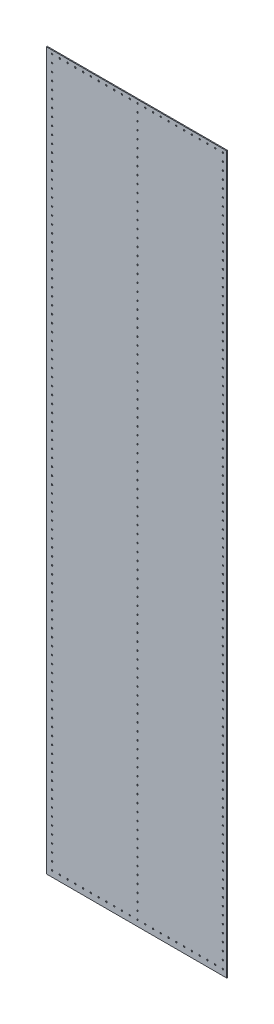
from build123d import *

# Parameters (mm, degrees)
BOSS_EXTRUDE1_DEPTH = 4613
CHAMFER1_SIZE       = 3
SKETCH4_R           = 4.7625
CUT_EXTRUDE1_DEPTH  = 4650.395309221


with BuildPart() as part:
    # Sketch3 → Boss-Extrude1 (new body)
    with BuildSketch(Plane(origin=(0, 0, 0), x_dir=(1, 0, 0), z_dir=(0, 1, 0))):
        Polygon((-578.87, 0), (578.87, 0), (580.602050808, 3), (-580.602050808, 3), align=None)
    extrude(amount=-BOSS_EXTRUDE1_DEPTH)

    # Chamfer1
    chamfer1_edges = [part.edges().sort_by_distance(p)[0] for p in [
        (0, 0, 0),
    ]]
    chamfer(chamfer1_edges, length=CHAMFER1_SIZE - 0.0001)  # a hair under: the kernel refuses the full size

    # Sketch4 → Cut-Extrude1 (cut, through all)
    with BuildSketch(Plane(origin=(0, 0, -3), x_dir=(-1, 0, 0), z_dir=(0, 0, -1))):
        with Locations((-555.602050808, -25)):
            Circle(SKETCH4_R)
        with Locations((-505.602050808, -25)):
            Circle(SKETCH4_R)
        with Locations((-455.602050808, -25)):
            Circle(SKETCH4_R)
        with Locations((-405.602050808, -25)):
            Circle(SKETCH4_R)
        with Locations((-355.602050808, -25)):
            Circle(SKETCH4_R)
        with Locations((-305.602050808, -25)):
            Circle(SKETCH4_R)
        with Locations((-255.602050808, -25)):
            Circle(SKETCH4_R)
        with Locations((-205.602050808, -25)):
            Circle(SKETCH4_R)
        with Locations((-155.602050808, -25)):
            Circle(SKETCH4_R)
        with Locations((-105.602050808, -25)):
            Circle(SKETCH4_R)
        with Locations((-55.602050808, -25)):
            Circle(SKETCH4_R)
        with Locations((-5.602050808, -25)):
            Circle(SKETCH4_R)
        with Locations((44.397949192, -25)):
            Circle(SKETCH4_R)
        with Locations((94.397949192, -25)):
            Circle(SKETCH4_R)
        with Locations((144.397949192, -25)):
            Circle(SKETCH4_R)
        with Locations((194.397949192, -25)):
            Circle(SKETCH4_R)
        with Locations((244.397949192, -25)):
            Circle(SKETCH4_R)
        with Locations((294.397949192, -25)):
            Circle(SKETCH4_R)
        with Locations((344.397949192, -25)):
            Circle(SKETCH4_R)
        with Locations((394.397949192, -25)):
            Circle(SKETCH4_R)
        with Locations((444.397949192, -25)):
            Circle(SKETCH4_R)
        with Locations((494.397949192, -25)):
            Circle(SKETCH4_R)
        with Locations((544.397949192, -25)):
            Circle(SKETCH4_R)
        with Locations((-555.602050808, -75)):
            Circle(SKETCH4_R)
        with Locations((-555.602050808, -125)):
            Circle(SKETCH4_R)
        with Locations((-555.602050808, -175)):
            Circle(SKETCH4_R)
        with Locations((-555.602050808, -225)):
            Circle(SKETCH4_R)
        with Locations((-555.602050808, -275)):
            Circle(SKETCH4_R)
        with Locations((-555.602050808, -325)):
            Circle(SKETCH4_R)
        with Locations((-555.602050808, -375)):
            Circle(SKETCH4_R)
        with Locations((-555.602050808, -425)):
            Circle(SKETCH4_R)
        with Locations((-555.602050808, -475)):
            Circle(SKETCH4_R)
        with Locations((-555.602050808, -525)):
            Circle(SKETCH4_R)
        with Locations((-555.602050808, -575)):
            Circle(SKETCH4_R)
        with Locations((-555.602050808, -625)):
            Circle(SKETCH4_R)
        with Locations((-555.602050808, -675)):
            Circle(SKETCH4_R)
        with Locations((-555.602050808, -725)):
            Circle(SKETCH4_R)
        with Locations((-555.602050808, -775)):
            Circle(SKETCH4_R)
        with Locations((-555.602050808, -825)):
            Circle(SKETCH4_R)
        with Locations((-555.602050808, -875)):
            Circle(SKETCH4_R)
        with Locations((-555.602050808, -925)):
            Circle(SKETCH4_R)
        with Locations((-555.602050808, -975)):
            Circle(SKETCH4_R)
        with Locations((-555.602050808, -1025)):
            Circle(SKETCH4_R)
        with Locations((-555.602050808, -1075)):
            Circle(SKETCH4_R)
        with Locations((-555.602050808, -1125)):
            Circle(SKETCH4_R)
        with Locations((-555.602050808, -1175)):
            Circle(SKETCH4_R)
        with Locations((-555.602050808, -1225)):
            Circle(SKETCH4_R)
        with Locations((-555.602050808, -1275)):
            Circle(SKETCH4_R)
        with Locations((-555.602050808, -1325)):
            Circle(SKETCH4_R)
        with Locations((-555.602050808, -1375)):
            Circle(SKETCH4_R)
        with Locations((-555.602050808, -1425)):
            Circle(SKETCH4_R)
        with Locations((-555.602050808, -1475)):
            Circle(SKETCH4_R)
        with Locations((-555.602050808, -1525)):
            Circle(SKETCH4_R)
        with Locations((-555.602050808, -1575)):
            Circle(SKETCH4_R)
        with Locations((-555.602050808, -1625)):
            Circle(SKETCH4_R)
        with Locations((-555.602050808, -1675)):
            Circle(SKETCH4_R)
        with Locations((-555.602050808, -1725)):
            Circle(SKETCH4_R)
        with Locations((-555.602050808, -1775)):
            Circle(SKETCH4_R)
        with Locations((-555.602050808, -1825)):
            Circle(SKETCH4_R)
        with Locations((-555.602050808, -1875)):
            Circle(SKETCH4_R)
        with Locations((-555.602050808, -1925)):
            Circle(SKETCH4_R)
        with Locations((-555.602050808, -1975)):
            Circle(SKETCH4_R)
        with Locations((-555.602050808, -2025)):
            Circle(SKETCH4_R)
        with Locations((-555.602050808, -2075)):
            Circle(SKETCH4_R)
        with Locations((-555.602050808, -2125)):
            Circle(SKETCH4_R)
        with Locations((-555.602050808, -2175)):
            Circle(SKETCH4_R)
        with Locations((-555.602050808, -2225)):
            Circle(SKETCH4_R)
        with Locations((-555.602050808, -2275)):
            Circle(SKETCH4_R)
        with Locations((-555.602050808, -2325)):
            Circle(SKETCH4_R)
        with Locations((-555.602050808, -2375)):
            Circle(SKETCH4_R)
        with Locations((-555.602050808, -2425)):
            Circle(SKETCH4_R)
        with Locations((-555.602050808, -2475)):
            Circle(SKETCH4_R)
        with Locations((-555.602050808, -2525)):
            Circle(SKETCH4_R)
        with Locations((-555.602050808, -2575)):
            Circle(SKETCH4_R)
        with Locations((-555.602050808, -2625)):
            Circle(SKETCH4_R)
        with Locations((-555.602050808, -2675)):
            Circle(SKETCH4_R)
        with Locations((-555.602050808, -2725)):
            Circle(SKETCH4_R)
        with Locations((-555.602050808, -2775)):
            Circle(SKETCH4_R)
        with Locations((-555.602050808, -2825)):
            Circle(SKETCH4_R)
        with Locations((-555.602050808, -2875)):
            Circle(SKETCH4_R)
        with Locations((-555.602050808, -2925)):
            Circle(SKETCH4_R)
        with Locations((-555.602050808, -2975)):
            Circle(SKETCH4_R)
        with Locations((-555.602050808, -3025)):
            Circle(SKETCH4_R)
        with Locations((-555.602050808, -3075)):
            Circle(SKETCH4_R)
        with Locations((-555.602050808, -3125)):
            Circle(SKETCH4_R)
        with Locations((-555.602050808, -3175)):
            Circle(SKETCH4_R)
        with Locations((-555.602050808, -3225)):
            Circle(SKETCH4_R)
        with Locations((-555.602050808, -3275)):
            Circle(SKETCH4_R)
        with Locations((-555.602050808, -3325)):
            Circle(SKETCH4_R)
        with Locations((-555.602050808, -3375)):
            Circle(SKETCH4_R)
        with Locations((-555.602050808, -3425)):
            Circle(SKETCH4_R)
        with Locations((-555.602050808, -3475)):
            Circle(SKETCH4_R)
        with Locations((-555.602050808, -3525)):
            Circle(SKETCH4_R)
        with Locations((-555.602050808, -3575)):
            Circle(SKETCH4_R)
        with Locations((-555.602050808, -3625)):
            Circle(SKETCH4_R)
        with Locations((-555.602050808, -3675)):
            Circle(SKETCH4_R)
        with Locations((-555.602050808, -3725)):
            Circle(SKETCH4_R)
        with Locations((-555.602050808, -3775)):
            Circle(SKETCH4_R)
        with Locations((-555.602050808, -3825)):
            Circle(SKETCH4_R)
        with Locations((-555.602050808, -3875)):
            Circle(SKETCH4_R)
        with Locations((-555.602050808, -3925)):
            Circle(SKETCH4_R)
        with Locations((-555.602050808, -3975)):
            Circle(SKETCH4_R)
        with Locations((-555.602050808, -4025)):
            Circle(SKETCH4_R)
        with Locations((-555.602050808, -4075)):
            Circle(SKETCH4_R)
        with Locations((-555.602050808, -4125)):
            Circle(SKETCH4_R)
        with Locations((-555.602050808, -4175)):
            Circle(SKETCH4_R)
        with Locations((-555.602050808, -4225)):
            Circle(SKETCH4_R)
        with Locations((-555.602050808, -4275)):
            Circle(SKETCH4_R)
        with Locations((-555.602050808, -4325)):
            Circle(SKETCH4_R)
        with Locations((-555.602050808, -4375)):
            Circle(SKETCH4_R)
        with Locations((-555.602050808, -4425)):
            Circle(SKETCH4_R)
        with Locations((-555.602050808, -4475)):
            Circle(SKETCH4_R)
        with Locations((-555.602050808, -4525)):
            Circle(SKETCH4_R)
        with Locations((-555.602050808, -4575)):
            Circle(SKETCH4_R)
        with Locations((-5.602050808, -75)):
            Circle(SKETCH4_R)
        with Locations((-5.602050808, -125)):
            Circle(SKETCH4_R)
        with Locations((-5.602050808, -175)):
            Circle(SKETCH4_R)
        with Locations((-5.602050808, -225)):
            Circle(SKETCH4_R)
        with Locations((-5.602050808, -275)):
            Circle(SKETCH4_R)
        with Locations((-5.602050808, -325)):
            Circle(SKETCH4_R)
        with Locations((-5.602050808, -375)):
            Circle(SKETCH4_R)
        with Locations((-5.602050808, -425)):
            Circle(SKETCH4_R)
        with Locations((-5.602050808, -475)):
            Circle(SKETCH4_R)
        with Locations((-5.602050808, -525)):
            Circle(SKETCH4_R)
        with Locations((-5.602050808, -575)):
            Circle(SKETCH4_R)
        with Locations((-5.602050808, -625)):
            Circle(SKETCH4_R)
        with Locations((-5.602050808, -675)):
            Circle(SKETCH4_R)
        with Locations((-5.602050808, -725)):
            Circle(SKETCH4_R)
        with Locations((-5.602050808, -775)):
            Circle(SKETCH4_R)
        with Locations((-5.602050808, -825)):
            Circle(SKETCH4_R)
        with Locations((-5.602050808, -875)):
            Circle(SKETCH4_R)
        with Locations((-5.602050808, -925)):
            Circle(SKETCH4_R)
        with Locations((-5.602050808, -975)):
            Circle(SKETCH4_R)
        with Locations((-5.602050808, -1025)):
            Circle(SKETCH4_R)
        with Locations((-5.602050808, -1075)):
            Circle(SKETCH4_R)
        with Locations((-5.602050808, -1125)):
            Circle(SKETCH4_R)
        with Locations((-5.602050808, -1175)):
            Circle(SKETCH4_R)
        with Locations((-5.602050808, -1225)):
            Circle(SKETCH4_R)
        with Locations((-5.602050808, -1275)):
            Circle(SKETCH4_R)
        with Locations((-5.602050808, -1325)):
            Circle(SKETCH4_R)
        with Locations((-5.602050808, -1375)):
            Circle(SKETCH4_R)
        with Locations((-5.602050808, -1425)):
            Circle(SKETCH4_R)
        with Locations((-5.602050808, -1475)):
            Circle(SKETCH4_R)
        with Locations((-5.602050808, -1525)):
            Circle(SKETCH4_R)
        with Locations((-5.602050808, -1575)):
            Circle(SKETCH4_R)
        with Locations((-5.602050808, -1625)):
            Circle(SKETCH4_R)
        with Locations((-5.602050808, -1675)):
            Circle(SKETCH4_R)
        with Locations((-5.602050808, -1725)):
            Circle(SKETCH4_R)
        with Locations((-5.602050808, -1775)):
            Circle(SKETCH4_R)
        with Locations((-5.602050808, -1825)):
            Circle(SKETCH4_R)
        with Locations((-5.602050808, -1875)):
            Circle(SKETCH4_R)
        with Locations((-5.602050808, -1925)):
            Circle(SKETCH4_R)
        with Locations((-5.602050808, -1975)):
            Circle(SKETCH4_R)
        with Locations((-5.602050808, -2025)):
            Circle(SKETCH4_R)
        with Locations((-5.602050808, -2075)):
            Circle(SKETCH4_R)
        with Locations((-5.602050808, -2125)):
            Circle(SKETCH4_R)
        with Locations((-5.602050808, -2175)):
            Circle(SKETCH4_R)
        with Locations((-5.602050808, -2225)):
            Circle(SKETCH4_R)
        with Locations((-5.602050808, -2275)):
            Circle(SKETCH4_R)
        with Locations((-5.602050808, -2325)):
            Circle(SKETCH4_R)
        with Locations((-5.602050808, -2375)):
            Circle(SKETCH4_R)
        with Locations((-5.602050808, -2425)):
            Circle(SKETCH4_R)
        with Locations((-5.602050808, -2475)):
            Circle(SKETCH4_R)
        with Locations((-5.602050808, -2525)):
            Circle(SKETCH4_R)
        with Locations((-5.602050808, -2575)):
            Circle(SKETCH4_R)
        with Locations((-5.602050808, -2625)):
            Circle(SKETCH4_R)
        with Locations((-5.602050808, -2675)):
            Circle(SKETCH4_R)
        with Locations((-5.602050808, -2725)):
            Circle(SKETCH4_R)
        with Locations((-5.602050808, -2775)):
            Circle(SKETCH4_R)
        with Locations((-5.602050808, -2825)):
            Circle(SKETCH4_R)
        with Locations((-5.602050808, -2875)):
            Circle(SKETCH4_R)
        with Locations((-5.602050808, -2925)):
            Circle(SKETCH4_R)
        with Locations((-5.602050808, -2975)):
            Circle(SKETCH4_R)
        with Locations((-5.602050808, -3025)):
            Circle(SKETCH4_R)
        with Locations((-5.602050808, -3075)):
            Circle(SKETCH4_R)
        with Locations((-5.602050808, -3125)):
            Circle(SKETCH4_R)
        with Locations((-5.602050808, -3175)):
            Circle(SKETCH4_R)
        with Locations((-5.602050808, -3225)):
            Circle(SKETCH4_R)
        with Locations((-5.602050808, -3275)):
            Circle(SKETCH4_R)
        with Locations((-5.602050808, -3325)):
            Circle(SKETCH4_R)
        with Locations((-5.602050808, -3375)):
            Circle(SKETCH4_R)
        with Locations((-5.602050808, -3425)):
            Circle(SKETCH4_R)
        with Locations((-5.602050808, -3475)):
            Circle(SKETCH4_R)
        with Locations((-5.602050808, -3525)):
            Circle(SKETCH4_R)
        with Locations((-5.602050808, -3575)):
            Circle(SKETCH4_R)
        with Locations((-5.602050808, -3625)):
            Circle(SKETCH4_R)
        with Locations((-5.602050808, -3675)):
            Circle(SKETCH4_R)
        with Locations((-5.602050808, -3725)):
            Circle(SKETCH4_R)
        with Locations((-5.602050808, -3775)):
            Circle(SKETCH4_R)
        with Locations((-5.602050808, -3825)):
            Circle(SKETCH4_R)
        with Locations((-5.602050808, -3875)):
            Circle(SKETCH4_R)
        with Locations((-5.602050808, -3925)):
            Circle(SKETCH4_R)
        with Locations((-5.602050808, -3975)):
            Circle(SKETCH4_R)
        with Locations((-5.602050808, -4025)):
            Circle(SKETCH4_R)
        with Locations((-5.602050808, -4075)):
            Circle(SKETCH4_R)
        with Locations((-5.602050808, -4125)):
            Circle(SKETCH4_R)
        with Locations((-5.602050808, -4175)):
            Circle(SKETCH4_R)
        with Locations((-5.602050808, -4225)):
            Circle(SKETCH4_R)
        with Locations((-5.602050808, -4275)):
            Circle(SKETCH4_R)
        with Locations((-5.602050808, -4325)):
            Circle(SKETCH4_R)
        with Locations((-5.602050808, -4375)):
            Circle(SKETCH4_R)
        with Locations((-5.602050808, -4425)):
            Circle(SKETCH4_R)
        with Locations((-5.602050808, -4475)):
            Circle(SKETCH4_R)
        with Locations((-5.602050808, -4525)):
            Circle(SKETCH4_R)
        with Locations((-5.602050808, -4575)):
            Circle(SKETCH4_R)
        with Locations((544.397949192, -75)):
            Circle(SKETCH4_R)
        with Locations((544.397949192, -125)):
            Circle(SKETCH4_R)
        with Locations((544.397949192, -175)):
            Circle(SKETCH4_R)
        with Locations((544.397949192, -225)):
            Circle(SKETCH4_R)
        with Locations((544.397949192, -275)):
            Circle(SKETCH4_R)
        with Locations((544.397949192, -325)):
            Circle(SKETCH4_R)
        with Locations((544.397949192, -375)):
            Circle(SKETCH4_R)
        with Locations((544.397949192, -425)):
            Circle(SKETCH4_R)
        with Locations((544.397949192, -475)):
            Circle(SKETCH4_R)
        with Locations((544.397949192, -525)):
            Circle(SKETCH4_R)
        with Locations((544.397949192, -575)):
            Circle(SKETCH4_R)
        with Locations((544.397949192, -625)):
            Circle(SKETCH4_R)
        with Locations((544.397949192, -675)):
            Circle(SKETCH4_R)
        with Locations((544.397949192, -725)):
            Circle(SKETCH4_R)
        with Locations((544.397949192, -775)):
            Circle(SKETCH4_R)
        with Locations((544.397949192, -825)):
            Circle(SKETCH4_R)
        with Locations((544.397949192, -875)):
            Circle(SKETCH4_R)
        with Locations((544.397949192, -925)):
            Circle(SKETCH4_R)
        with Locations((544.397949192, -975)):
            Circle(SKETCH4_R)
        with Locations((544.397949192, -1025)):
            Circle(SKETCH4_R)
        with Locations((544.397949192, -1075)):
            Circle(SKETCH4_R)
        with Locations((544.397949192, -1125)):
            Circle(SKETCH4_R)
        with Locations((544.397949192, -1175)):
            Circle(SKETCH4_R)
        with Locations((544.397949192, -1225)):
            Circle(SKETCH4_R)
        with Locations((544.397949192, -1275)):
            Circle(SKETCH4_R)
        with Locations((544.397949192, -1325)):
            Circle(SKETCH4_R)
        with Locations((544.397949192, -1375)):
            Circle(SKETCH4_R)
        with Locations((544.397949192, -1425)):
            Circle(SKETCH4_R)
        with Locations((544.397949192, -1475)):
            Circle(SKETCH4_R)
        with Locations((544.397949192, -1525)):
            Circle(SKETCH4_R)
        with Locations((544.397949192, -1575)):
            Circle(SKETCH4_R)
        with Locations((544.397949192, -1625)):
            Circle(SKETCH4_R)
        with Locations((544.397949192, -1675)):
            Circle(SKETCH4_R)
        with Locations((544.397949192, -1725)):
            Circle(SKETCH4_R)
        with Locations((544.397949192, -1775)):
            Circle(SKETCH4_R)
        with Locations((544.397949192, -1825)):
            Circle(SKETCH4_R)
        with Locations((544.397949192, -1875)):
            Circle(SKETCH4_R)
        with Locations((544.397949192, -1925)):
            Circle(SKETCH4_R)
        with Locations((544.397949192, -1975)):
            Circle(SKETCH4_R)
        with Locations((544.397949192, -2025)):
            Circle(SKETCH4_R)
        with Locations((544.397949192, -2075)):
            Circle(SKETCH4_R)
        with Locations((544.397949192, -2125)):
            Circle(SKETCH4_R)
        with Locations((544.397949192, -2175)):
            Circle(SKETCH4_R)
        with Locations((544.397949192, -2225)):
            Circle(SKETCH4_R)
        with Locations((544.397949192, -2275)):
            Circle(SKETCH4_R)
        with Locations((544.397949192, -2325)):
            Circle(SKETCH4_R)
        with Locations((544.397949192, -2375)):
            Circle(SKETCH4_R)
        with Locations((544.397949192, -2425)):
            Circle(SKETCH4_R)
        with Locations((544.397949192, -2475)):
            Circle(SKETCH4_R)
        with Locations((544.397949192, -2525)):
            Circle(SKETCH4_R)
        with Locations((544.397949192, -2575)):
            Circle(SKETCH4_R)
        with Locations((544.397949192, -2625)):
            Circle(SKETCH4_R)
        with Locations((544.397949192, -2675)):
            Circle(SKETCH4_R)
        with Locations((544.397949192, -2725)):
            Circle(SKETCH4_R)
        with Locations((544.397949192, -2775)):
            Circle(SKETCH4_R)
        with Locations((544.397949192, -2825)):
            Circle(SKETCH4_R)
        with Locations((544.397949192, -2875)):
            Circle(SKETCH4_R)
        with Locations((544.397949192, -2925)):
            Circle(SKETCH4_R)
        with Locations((544.397949192, -2975)):
            Circle(SKETCH4_R)
        with Locations((544.397949192, -3025)):
            Circle(SKETCH4_R)
        with Locations((544.397949192, -3075)):
            Circle(SKETCH4_R)
        with Locations((544.397949192, -3125)):
            Circle(SKETCH4_R)
        with Locations((544.397949192, -3175)):
            Circle(SKETCH4_R)
        with Locations((544.397949192, -3225)):
            Circle(SKETCH4_R)
        with Locations((544.397949192, -3275)):
            Circle(SKETCH4_R)
        with Locations((544.397949192, -3325)):
            Circle(SKETCH4_R)
        with Locations((544.397949192, -3375)):
            Circle(SKETCH4_R)
        with Locations((544.397949192, -3425)):
            Circle(SKETCH4_R)
        with Locations((544.397949192, -3475)):
            Circle(SKETCH4_R)
        with Locations((544.397949192, -3525)):
            Circle(SKETCH4_R)
        with Locations((544.397949192, -3575)):
            Circle(SKETCH4_R)
        with Locations((544.397949192, -3625)):
            Circle(SKETCH4_R)
        with Locations((544.397949192, -3675)):
            Circle(SKETCH4_R)
        with Locations((544.397949192, -3725)):
            Circle(SKETCH4_R)
        with Locations((544.397949192, -3775)):
            Circle(SKETCH4_R)
        with Locations((544.397949192, -3825)):
            Circle(SKETCH4_R)
        with Locations((544.397949192, -3875)):
            Circle(SKETCH4_R)
        with Locations((544.397949192, -3925)):
            Circle(SKETCH4_R)
        with Locations((544.397949192, -3975)):
            Circle(SKETCH4_R)
        with Locations((544.397949192, -4025)):
            Circle(SKETCH4_R)
        with Locations((544.397949192, -4075)):
            Circle(SKETCH4_R)
        with Locations((544.397949192, -4125)):
            Circle(SKETCH4_R)
        with Locations((544.397949192, -4175)):
            Circle(SKETCH4_R)
        with Locations((544.397949192, -4225)):
            Circle(SKETCH4_R)
        with Locations((544.397949192, -4275)):
            Circle(SKETCH4_R)
        with Locations((544.397949192, -4325)):
            Circle(SKETCH4_R)
        with Locations((544.397949192, -4375)):
            Circle(SKETCH4_R)
        with Locations((544.397949192, -4425)):
            Circle(SKETCH4_R)
        with Locations((544.397949192, -4475)):
            Circle(SKETCH4_R)
        with Locations((544.397949192, -4525)):
            Circle(SKETCH4_R)
        with Locations((544.397949192, -4575)):
            Circle(SKETCH4_R)
        with Locations((-505.602050808, -4575)):
            Circle(SKETCH4_R)
        with Locations((-455.602050808, -4575)):
            Circle(SKETCH4_R)
        with Locations((-405.602050808, -4575)):
            Circle(SKETCH4_R)
        with Locations((-355.602050808, -4575)):
            Circle(SKETCH4_R)
        with Locations((-305.602050808, -4575)):
            Circle(SKETCH4_R)
        with Locations((-255.602050808, -4575)):
            Circle(SKETCH4_R)
        with Locations((-205.602050808, -4575)):
            Circle(SKETCH4_R)
        with Locations((-155.602050808, -4575)):
            Circle(SKETCH4_R)
        with Locations((-105.602050808, -4575)):
            Circle(SKETCH4_R)
        with Locations((-55.602050808, -4575)):
            Circle(SKETCH4_R)
        with Locations((44.397949192, -4575)):
            Circle(SKETCH4_R)
        with Locations((94.397949192, -4575)):
            Circle(SKETCH4_R)
        with Locations((144.397949192, -4575)):
            Circle(SKETCH4_R)
        with Locations((194.397949192, -4575)):
            Circle(SKETCH4_R)
        with Locations((244.397949192, -4575)):
            Circle(SKETCH4_R)
        with Locations((294.397949192, -4575)):
            Circle(SKETCH4_R)
        with Locations((344.397949192, -4575)):
            Circle(SKETCH4_R)
        with Locations((394.397949192, -4575)):
            Circle(SKETCH4_R)
        with Locations((444.397949192, -4575)):
            Circle(SKETCH4_R)
        with Locations((494.397949192, -4575)):
            Circle(SKETCH4_R)
    extrude(amount=-CUT_EXTRUDE1_DEPTH, mode=Mode.SUBTRACT)


solid = part.part
